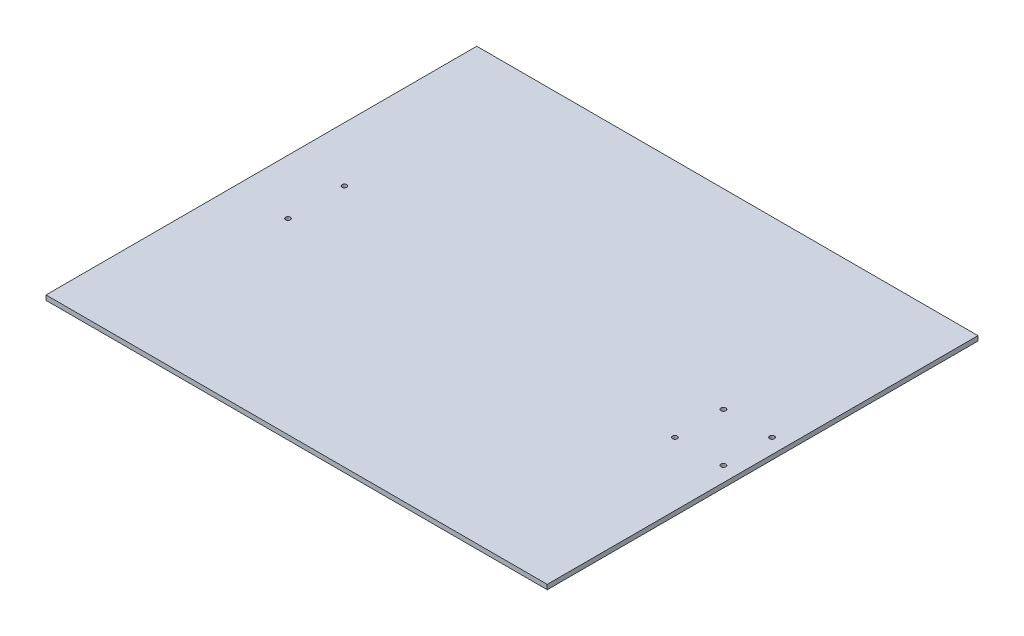
from build123d import *

# Parameters (mm, degrees)
SKETCH1_W                      = 320
SKETCH1_H                      = 275
BOSS_EXTRUDE1_DEPTH            = 3
TALADRO_DE_MARGEN_PARA_M2_51_D = 3.1
SKETCH6_R                      = 1.5
CUT_EXTRUDE1_DEPTH             = 211.986373968


with BuildPart() as part:
    # Sketch1 → Boss-Extrude1 (new body)
    with BuildSketch(Plane(origin=(0, 0, 0), x_dir=(1, 0, 0), z_dir=(0, 1, 0))):
        Rectangle(SKETCH1_W, SKETCH1_H)
    extrude(amount=BOSS_EXTRUDE1_DEPTH)

    # Taladro de margen para M2.51 (through all)
    with Locations(Plane(origin=(0, 3, 0), x_dir=(1, 0, 0), z_dir=(0, 1, 0))):
        with Locations((150.5, 15.5), (150.5, -15.5), (119.5, -15.5), (119.5, 15.5)):
            Hole(TALADRO_DE_MARGEN_PARA_M2_51_D / 2)

    # Sketch6 → Cut-Extrude1 (cut, through all)
    with BuildSketch(Plane(origin=(0, 3, 0), x_dir=(1, 0, 0), z_dir=(0, 1, 0))):
        with Locations((-125, -18)):
            Circle(SKETCH6_R)
        with Locations((-125, 18)):
            Circle(SKETCH6_R)
    extrude(amount=-CUT_EXTRUDE1_DEPTH, mode=Mode.SUBTRACT)


solid = part.part
